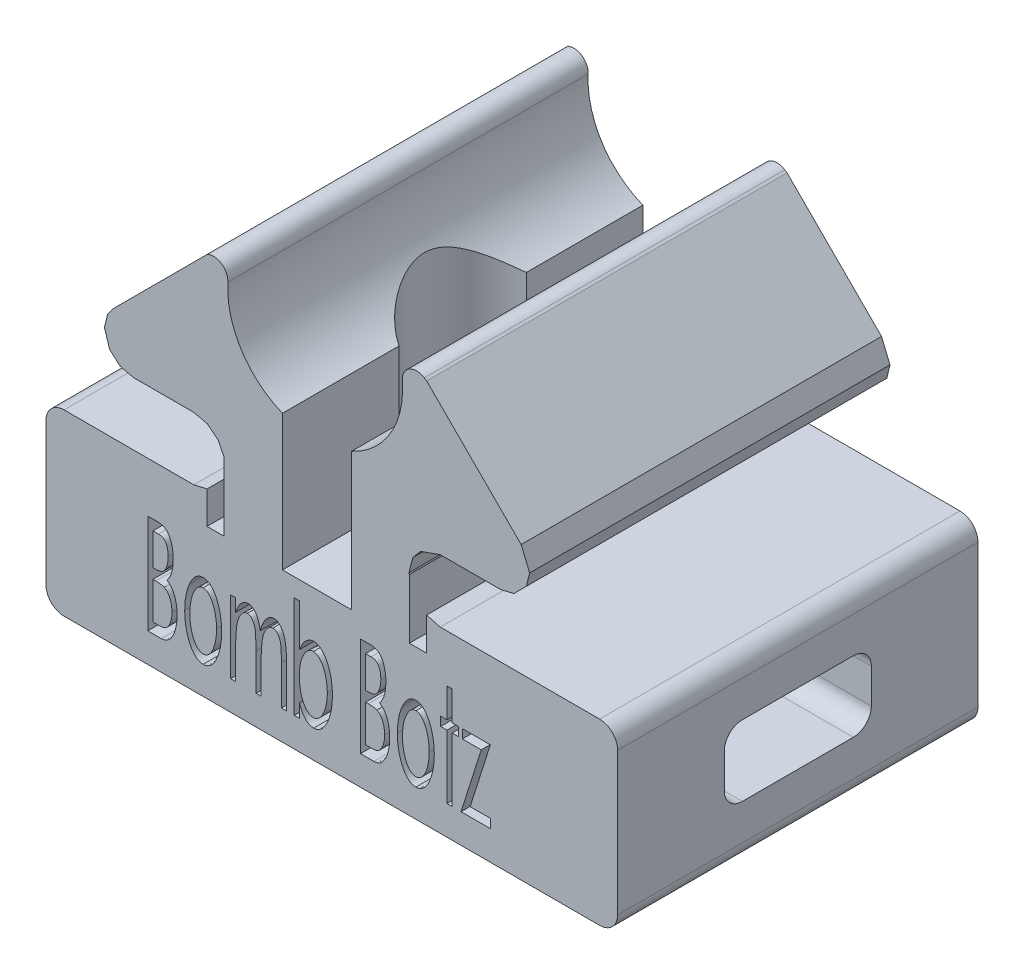
from build123d import *

# Parameters (mm, degrees)
BOSS_EXTRUDE1_DEPTH = 12.7
SKETCH10_R          = 3.082136138
CUT_EXTRUDE1_DEPTH  = 26.185474767
SKETCH11_W          = 2.435876878
SKETCH11_H          = 7.908405343
CUT_EXTRUDE2_DEPTH  = 26.185474767
SKETCH13_W          = 5.182015338
SKETCH13_H          = 2.489456313
CUT_EXTRUDE4_DEPTH  = 31.460304214
FILLET1_R           = 0.635
FILLET2_R           = 0.635
FILLET3_R           = 0.508
CUT_EXTRUDE5_DEPTH  = 1.27
SKETCH17_W          = 0.605016918
SKETCH17_H          = 2.095446093
SKETCH17_W_2        = 0.604461085
SKETCH17_H_2        = 2.141007526
CUT_EXTRUDE7_DEPTH  = 26.185474884
SKETCH18_R          = 2.54
CUT_EXTRUDE8_DEPTH  = 22.473952086


with BuildPart() as part:
    # Sketch5 → Boss-Extrude1 (new body)
    with BuildSketch(Plane.XY):
        Polygon((-6.474794456, -10.4902), (-6.938297275, -10.378313453), (-7.308763147, -10.05450356), (-7.490794456, -9.4742), (-7.378907909, -9.01069718), (-7.193214945, -8.75577951), (-3.863171405, -5.42573597), (-2.833127272, -4.737482484), (-1.618107374, -4.4958), (1.618107374, -4.4958), (2.668236067, -4.674493152), (3.863171405, -5.42573597), (7.193214945, -8.75577951), (7.490794456, -9.4742), (7.378907909, -9.93770282), (6.938297275, -10.378313453), (6.474794456, -10.4902), (4.3434, -10.4902), (3.646537163, -10.737670005), (3.377082754, -11.059343535), (3.2385, -11.5951), (3.485970005, -12.291962837), (3.807643535, -12.561417246), (4.3434, -12.7), (10.5918, -12.7), (10.5918, -18.995576116), (-9.5504, -18.995576116), (-9.5504, -12.7), (-4.3434, -12.7), (-3.863171405, -12.590180165), (-3.485969976, -12.291962837), (-3.271081829, -11.861441531), (-3.271081829, -11.328758469), (-3.485969976, -10.898237163), (-3.863171405, -10.600019835), (-4.3434, -10.4902), align=None)
    extrude(amount=-BOSS_EXTRUDE1_DEPTH)

    # Sketch10 → Cut-Extrude1 (cut, through all)
    with BuildSketch(Plane.XY):
        with Locations((-0.066530556, -6.095976424)):
            Circle(SKETCH10_R)
    extrude(amount=-CUT_EXTRUDE1_DEPTH, mode=Mode.SUBTRACT)

    # Sketch11 → Cut-Extrude2 (cut, through all)
    with BuildSketch(Plane.XY):
        with Locations((0, -9.781904855)):
            Rectangle(SKETCH11_W, SKETCH11_H)
    extrude(amount=-CUT_EXTRUDE2_DEPTH, mode=Mode.SUBTRACT)

    # Sketch13 → Cut-Extrude4 (cut, through all)
    with BuildSketch(Plane.ZY.offset(9.5504)):
        with Locations((-6.35, -15.847788058)):
            Rectangle(SKETCH13_W, SKETCH13_H)
    extrude(amount=-CUT_EXTRUDE4_DEPTH, mode=Mode.SUBTRACT)

    # Fillet1
    fillet1_edges = [part.edges().sort_by_distance(p)[0] for p in [
        (-9.5504, -12.7, -6.35),
    ]]
    fillet(fillet1_edges, radius=FILLET1_R)

    # Fillet2
    fillet2_edges = [part.edges().sort_by_distance(p)[0] for p in [
        (0.5207, -14.603059901, -3.758992331),
        (0.5207, -17.092516214, -3.758992331),
        (0.5207, -17.092516214, -8.941007669),
        (0.5207, -14.603059901, -8.941007669),
        (10.5918, -12.7, -6.35),
        (10.5918, -18.995576116, -6.35),
        (-9.5504, -18.995576116, -6.35),
    ]]
    fillet(fillet2_edges, radius=FILLET2_R)

    # Fillet3
    # the kernel refuses this fillet: 0.508 mm, written as the material it takes off along each edge
    with BuildSketch(Plane(origin=(2.668236067, -4.674493152, 3.28944818), x_dir=(0.8465916632907232, -0.5322429479538895, 0), z_dir=(0, 0, -1))) as fillet3_piece_1:
        with BuildLine():
            CenterArc((1.315779272, 0.508), FILLET3_R, 143.192029884, 126.807970116)
            Line((0.90905007, 0.812360569), (0.900915486, 0.81844778))
            ThreePointArc((0.900915486, 0.81844778), (0.488321858, 0.368360866), (-0.005137978, 0.008765089))
            Line((-0.005137978, 0.008765089), (0, -0.01016))
            Line((0, -0.01016), (1.315779272, -0.01016))
            Line((1.315779272, -0.01016), (1.315779272, 0))
        make_face()
    extrude(amount=19.278896361, mode=Mode.SUBTRACT)
    with BuildSketch(Plane(origin=(-2.833127272, -4.737482484, 3.097058862), x_dir=(-0.8314696122997464, -0.5555702330237908, 0), z_dir=(0, 0, -1))) as fillet3_piece_2:
        with BuildLine():
            CenterArc((1.31839441, -0.501729486), FILLET3_R, 99.011665767, 118.073467257)
            Line((0.913142276, -0.808054001), (0.905037233, -0.814180491))
            ThreePointArc((0.905037233, -0.814180491), (0.490196501, -0.366028623), (-0.005094947, -0.008790172))
            Line((-0.005094947, -0.008790172), (0, 0.01016))
            ThreePointArc((0, 0.01016), (0.619411772, 0.01016), (1.237232128, 0.01003459))
            Line((1.237232128, 0.01003459), (1.238823545, 0))
        make_face()
    extrude(amount=18.894117724, mode=Mode.SUBTRACT)

    # Sketch15 → Cut-Extrude5 (cut)
    # profile 1 of 8: a face of its own
    with BuildSketch(Plane.XY):
        with BuildLine():
            Line((-5.963589534, -14.467780526), (-5.62214322, -14.467780526))
            add(Edge.make_bspline(
                [(-5.62214322, -14.467780526), (-5.589534178, -14.46878798), (-5.527901506, -14.470692118), (-5.441516013, -14.490243243), (-5.365936065, -14.520174515), (-5.302987249, -14.566695465), (-5.249771139, -14.625144193), (-5.202864844, -14.696129356), (-5.163082389, -14.780723785), (-5.128349989, -14.876964552), (-5.101094391, -14.98243947), (-5.080415702, -15.094850671), (-5.068697057, -15.213056959), (-5.067011592, -15.293910926), (-5.066153636, -15.335068186)],
                knots=[0, 0, 0, 0, 1.007703189, 1.904607924, 2.728231251, 3.505327209, 4.303946819, 5.16473243, 6.128960489, 7.190833427, 8.327918668, 9.497182713, 10.725985794, 12, 12, 12, 12], degree=3))
            add(Edge.make_bspline(
                [(-5.066153636, -15.335068186), (-5.06679237, -15.37365502), (-5.068041356, -15.449108083), (-5.078819113, -15.559683483), (-5.09614865, -15.664916555), (-5.120267823, -15.7642439), (-5.151770234, -15.856240685), (-5.1893233, -15.939825865), (-5.233419851, -16.014982543), (-5.269354712, -16.058354109), (-5.287007002, -16.079659533)],
                knots=[0, 0, 0, 0, 1.167664483, 2.283262239, 3.358923896, 4.393422853, 5.373199395, 6.29755825, 7.163709169, 8, 8, 8, 8], degree=3))
            add(Edge.make_bspline(
                [(-5.287007002, -16.079659533), (-5.265820126, -16.095080339), (-5.224295143, -16.125304178), (-5.169500865, -16.178012614), (-5.121183642, -16.233812414), (-5.081674484, -16.295437248), (-5.048107352, -16.361552921), (-5.017327508, -16.432968522), (-4.992028559, -16.511264668), (-4.970278844, -16.595558431), (-4.953059318, -16.684537391), (-4.940091307, -16.777884919), (-4.933516036, -16.874870461), (-4.932203241, -16.940862846), (-4.931538252, -16.974290943)],
                knots=[0, 0, 0, 0, 0.940213205, 1.842760421, 2.724135194, 3.585617653, 4.464149597, 5.385626676, 6.375777621, 7.416178614, 8.510967562, 9.629286614, 10.799127532, 12, 12, 12, 12], degree=3))
            add(Edge.make_bspline(
                [(-4.931538252, -16.974290943), (-4.931796917, -17.008429669), (-4.932304329, -17.075398123), (-4.940567322, -17.17364715), (-4.952378885, -17.267695274), (-4.968054258, -17.358033369), (-4.990305018, -17.444204206), (-5.01563402, -17.526922141), (-5.046920587, -17.605290821), (-5.082042167, -17.678765991), (-5.121005728, -17.746111774), (-5.163309515, -17.805500706), (-5.210257707, -17.854922704), (-5.259417575, -17.896441948), (-5.312482472, -17.928350746), (-5.368830889, -17.950905706), (-5.428325845, -17.965867284), (-5.469440698, -17.967135904), (-5.490332322, -17.967780526)],
                knots=[0, 0, 0, 0, 1.305706815, 2.561348188, 3.769087172, 4.931904447, 6.066077104, 7.171803036, 8.239419409, 9.29119266, 10.284925843, 11.21314407, 12.073370583, 12.886194184, 13.668239408, 14.430351689, 15.202417108, 16, 16, 16, 16], degree=3))
            Line((-5.490332322, -17.967780526), (-5.963589534, -17.967780526))
            Line((-5.963589534, -17.967780526), (-5.963589534, -14.467780526))
        make_face()
        with BuildLine():
            Line((-5.784102354, -14.826754885), (-5.784102354, -15.948549757))
            Line((-5.784102354, -15.948549757), (-5.686646425, -15.948549757))
            add(Edge.make_bspline(
                [(-5.686646425, -15.948549757), (-5.659024836, -15.947836275), (-5.607419502, -15.946503279), (-5.535531687, -15.934491662), (-5.475447719, -15.912718893), (-5.425307923, -15.882594026), (-5.384948483, -15.841407515), (-5.349161734, -15.792451241), (-5.319359759, -15.732824027), (-5.29311326, -15.665473087), (-5.271485576, -15.590896983), (-5.256477584, -15.511302634), (-5.246952842, -15.42761469), (-5.246085687, -15.370618638), (-5.245640816, -15.341378283)],
                knots=[0, 0, 0, 0, 1.158126998, 2.163725294, 3.041371376, 3.824793678, 4.594170469, 5.443102772, 6.359364395, 7.380511659, 8.472453147, 9.610495495, 10.77412628, 12, 12, 12, 12], degree=3))
            add(Edge.make_bspline(
                [(-5.245640816, -15.341378283), (-5.24643037, -15.303463298), (-5.247929231, -15.231486835), (-5.263088834, -15.129866037), (-5.288825731, -15.041027529), (-5.319010095, -14.976200149), (-5.34839721, -14.931644521), (-5.373618308, -14.903711491), (-5.401732116, -14.880006633), (-5.432539782, -14.859931293), (-5.467482314, -14.845732101), (-5.504641724, -14.834052065), (-5.545054209, -14.827941221), (-5.572813815, -14.827157735), (-5.58708713, -14.826754885)],
                knots=[0, 0, 0, 0, 1.952265271, 3.706111235, 5.27563019, 6.702738451, 7.37059395, 8.018508953, 8.633599442, 9.261517843, 9.903363777, 10.569915718, 11.264685426, 12, 12, 12, 12], degree=3))
            Line((-5.58708713, -14.826754885), (-5.784102354, -14.826754885))
        make_face(mode=Mode.SUBTRACT)
        with BuildLine():
            Line((-5.784102354, -16.307524116), (-5.784102354, -17.608806167))
            Line((-5.784102354, -17.608806167), (-5.574466938, -17.608806167))
            add(Edge.make_bspline(
                [(-5.574466938, -17.608806167), (-5.545407451, -17.608279987), (-5.491098027, -17.607296608), (-5.416043649, -17.593031784), (-5.352619022, -17.571529907), (-5.301002884, -17.538212916), (-5.258588115, -17.495091397), (-5.222477059, -17.442073954), (-5.189088856, -17.380049388), (-5.162193525, -17.308103991), (-5.139049701, -17.23018603), (-5.12321637, -17.147500883), (-5.113116047, -17.061948199), (-5.111728433, -17.003767041), (-5.111025431, -16.974290943)],
                knots=[0, 0, 0, 0, 1.164888785, 2.177066614, 3.05569501, 3.836540044, 4.619468312, 5.468124174, 6.404245127, 7.441045181, 8.545645698, 9.66450176, 10.816775421, 12, 12, 12, 12], degree=3))
            add(Edge.make_bspline(
                [(-5.111025431, -16.974290943), (-5.112049658, -16.937796388), (-5.114039567, -16.866893291), (-5.127041238, -16.764109234), (-5.150280649, -16.668661019), (-5.182292887, -16.581426879), (-5.221313133, -16.50341528), (-5.268708874, -16.438209418), (-5.322335588, -16.384438771), (-5.364892372, -16.360625795), (-5.385865175, -16.348890302)],
                knots=[0, 0, 0, 0, 1.222452466, 2.375030106, 3.46297454, 4.505675201, 5.48249602, 6.37345105, 7.198405334, 8, 8, 8, 8], degree=3))
            add(Edge.make_bspline(
                [(-5.385865175, -16.348890302), (-5.402761888, -16.342238106), (-5.44117002, -16.327116914), (-5.509900884, -16.316718034), (-5.5936596, -16.308808196), (-5.654827904, -16.307976055), (-5.688048668, -16.307524116)],
                knots=[0, 0, 0, 0, 0.708155266, 1.609716739, 2.701827025, 4, 4, 4, 4], degree=3))
            Line((-5.688048668, -16.307524116), (-5.784102354, -16.307524116))
        make_face(mode=Mode.SUBTRACT)
    # profile 2 of 8: a face of its own
    with BuildSketch(Plane.XY):
        with BuildLine():
            add(Edge.make_bspline(
                [(-4.010965335, -15.365216424), (-3.987202577, -15.366280698), (-3.939938498, -15.368397537), (-3.871505784, -15.390184301), (-3.806668863, -15.424042529), (-3.744146766, -15.470102283), (-3.686232268, -15.530740461), (-3.631389386, -15.603917735), (-3.579378926, -15.689950096), (-3.549286287, -15.753339913), (-3.533501393, -15.786590622)],
                knots=[0, 0, 0, 0, 0.843577701, 1.677874383, 2.529941952, 3.44009667, 4.428447994, 5.503311921, 6.690378774, 8, 8, 8, 8], degree=3))
            add(Edge.make_bspline(
                [(-3.533501393, -15.786590622), (-3.519491202, -15.819131254), (-3.491125789, -15.885013897), (-3.456655297, -15.988080509), (-3.427184931, -16.095315949), (-3.402160687, -16.206805054), (-3.384970642, -16.323147295), (-3.370077074, -16.443447004), (-3.362863943, -16.568252573), (-3.361644666, -16.65293694), (-3.361025431, -16.69594559)],
                knots=[0, 0, 0, 0, 0.911590579, 1.845630971, 2.79426017, 3.773633235, 4.784390523, 5.820063118, 6.892875455, 8, 8, 8, 8], degree=3))
            add(Edge.make_bspline(
                [(-3.361025431, -16.69594559), (-3.361572897, -16.739192091), (-3.362651139, -16.824366626), (-3.37090819, -16.950086518), (-3.386174601, -17.071620024), (-3.404944066, -17.189345325), (-3.431700919, -17.30258021), (-3.461713559, -17.412049943), (-3.499500821, -17.516938511), (-3.541458488, -17.616603421), (-3.587318855, -17.708603167), (-3.638080994, -17.788948002), (-3.691023083, -17.857925388), (-3.748369165, -17.914123077), (-3.808887337, -17.958344391), (-3.873066612, -17.989976554), (-3.940946523, -18.008956451), (-3.987476748, -18.0114125), (-4.010965335, -18.012652321)],
                knots=[0, 0, 0, 0, 1.301298947, 2.562924903, 3.788461415, 4.986201962, 6.14793309, 7.287790237, 8.39993342, 9.49971249, 10.540722194, 11.488924044, 12.355509222, 13.151197152, 13.89676473, 14.601269901, 15.293917145, 16, 16, 16, 16], degree=3))
            add(Edge.make_bspline(
                [(-4.010965335, -18.012652321), (-4.034447933, -18.011387838), (-4.081191959, -18.008870782), (-4.149369699, -17.990121666), (-4.213761248, -17.958353131), (-4.274315659, -17.913932457), (-4.332295632, -17.857975775), (-4.386002732, -17.789163365), (-4.436693222, -17.708580269), (-4.482509623, -17.616586344), (-4.524808833, -17.517109534), (-4.561115474, -17.411749669), (-4.592928896, -17.302850789), (-4.617764342, -17.189125104), (-4.638446077, -17.071781546), (-4.652069501, -16.950009813), (-4.660775452, -16.824379546), (-4.661791563, -16.739196442), (-4.662307483, -16.69594559)],
                knots=[0, 0, 0, 0, 0.705440217, 1.4042363, 2.108100269, 2.852989273, 3.652997896, 4.523145192, 5.47048404, 6.510546275, 7.609324387, 8.718120464, 9.858867499, 11.017987859, 12.215813406, 13.439407729, 14.699885423, 16, 16, 16, 16], degree=3))
            add(Edge.make_bspline(
                [(-4.662307483, -16.69594559), (-4.661692969, -16.6531693), (-4.660479734, -16.568716052), (-4.653158423, -16.444164378), (-4.638734442, -16.323982861), (-4.620028849, -16.208371479), (-4.596193049, -16.096905412), (-4.566883832, -15.989878754), (-4.532055218, -15.88693716), (-4.503820373, -15.821242279), (-4.489831521, -15.788693988)],
                knots=[0, 0, 0, 0, 1.103600926, 2.178839769, 3.216854868, 4.224898256, 5.199312966, 6.155900535, 7.086347569, 8, 8, 8, 8], degree=3))
            add(Edge.make_bspline(
                [(-4.489831521, -15.788693988), (-4.474076444, -15.755193626), (-4.444121502, -15.691499782), (-4.391770495, -15.605051551), (-4.336662092, -15.531607251), (-4.278278402, -15.47116933), (-4.216700031, -15.423544314), (-4.151036233, -15.390265385), (-4.082220383, -15.368444874), (-4.034729354, -15.366293133), (-4.010965335, -15.365216424)],
                knots=[0, 0, 0, 0, 1.3116991, 2.493918051, 3.576000503, 4.560315464, 5.46508553, 6.321043193, 7.159867415, 8, 8, 8, 8], degree=3))
        make_face()
        with BuildLine():
            add(Edge.make_bspline(
                [(-4.011666457, -15.679318988), (-4.02766861, -15.680288622), (-4.059590517, -15.682222898), (-4.106161569, -15.69726926), (-4.150823162, -15.720629207), (-4.193456831, -15.754082854), (-4.234744119, -15.796042499), (-4.273132084, -15.848242325), (-4.310400991, -15.908977592), (-4.345516199, -15.978164139), (-4.377205156, -16.054295668), (-4.406154237, -16.134615747), (-4.429970545, -16.218969048), (-4.448660164, -16.307367435), (-4.464095488, -16.399508548), (-4.475388436, -16.495655751), (-4.481626503, -16.595600463), (-4.482417154, -16.663451854), (-4.482820303, -16.698048956)],
                knots=[0, 0, 0, 0, 0.633328474, 1.263395849, 1.922297409, 2.622747561, 3.402359392, 4.249154536, 5.185072166, 6.225072861, 7.321168891, 8.452296706, 9.607823688, 10.792618436, 12.032427099, 13.310317054, 14.628543482, 16, 16, 16, 16], degree=3))
            add(Edge.make_bspline(
                [(-4.482820303, -16.698048956), (-4.481983217, -16.742714023), (-4.480332326, -16.830801916), (-4.468144573, -16.960540589), (-4.448678688, -17.08563532), (-4.421710713, -17.204465543), (-4.3881774, -17.314706881), (-4.34752978, -17.412579999), (-4.30313266, -17.498328555), (-4.252018464, -17.569291109), (-4.19696323, -17.626499948), (-4.137844282, -17.667210228), (-4.076062094, -17.694418002), (-4.032961036, -17.697183454), (-4.011666457, -17.698549757)],
                knots=[0, 0, 0, 0, 1.343625255, 2.649881141, 3.916827948, 5.150040387, 6.313170605, 7.378672881, 8.334918638, 9.211145051, 10.001680462, 10.70963726, 11.362481287, 12, 12, 12, 12], degree=3))
            add(Edge.make_bspline(
                [(-4.011666457, -17.698549757), (-3.990369901, -17.697185509), (-3.947264841, -17.694424218), (-3.885514088, -17.667183763), (-3.826395718, -17.62670676), (-3.772009812, -17.569044862), (-3.721018335, -17.498165071), (-3.67549436, -17.412945113), (-3.636082439, -17.31450229), (-3.60244675, -17.204401311), (-3.574436639, -17.085734345), (-3.555251226, -16.960527488), (-3.542984135, -16.830805344), (-3.541344161, -16.742715176), (-3.540512611, -16.698048956)],
                knots=[0, 0, 0, 0, 0.63766136, 1.290651464, 1.99876667, 2.784553339, 3.660975812, 4.620765142, 5.683833951, 6.847224424, 8.082295646, 9.349525938, 10.656074103, 12, 12, 12, 12], degree=3))
            add(Edge.make_bspline(
                [(-3.540512611, -16.698048956), (-3.540917405, -16.663452192), (-3.541711282, -16.595601464), (-3.547926106, -16.495651974), (-3.55930322, -16.399522074), (-3.574447572, -16.3072699), (-3.594205809, -16.219039843), (-3.618090984, -16.134784375), (-3.645763882, -16.053971854), (-3.678714058, -15.978336365), (-3.713642118, -15.909008419), (-3.750767855, -15.847948896), (-3.790082493, -15.796526425), (-3.830551542, -15.753837561), (-3.873247933, -15.720664094), (-3.917863454, -15.697259641), (-3.964221929, -15.68230091), (-3.995901747, -15.680309811), (-4.011666457, -15.679318988)],
                knots=[0, 0, 0, 0, 1.372102031, 2.690948916, 3.969440344, 5.209832555, 6.397176509, 7.553247371, 8.681828641, 9.782077646, 10.822567844, 11.758925988, 12.611729478, 13.385237583, 14.08601742, 14.74522911, 15.375593043, 16, 16, 16, 16], degree=3))
        make_face(mode=Mode.SUBTRACT)
    # profile 3 of 8: a face of its own
    with BuildSketch(Plane.XY):
        with BuildLine():
            Line((-3.046922867, -15.410088218), (-2.867435688, -15.410088218))
            Line((-2.867435688, -15.410088218), (-2.867435688, -15.854599436))
            add(Edge.make_bspline(
                [(-2.867435688, -15.854599436), (-2.853298321, -15.816026088), (-2.826740088, -15.743562812), (-2.780775186, -15.645548815), (-2.736282157, -15.562696143), (-2.701775979, -15.516330211), (-2.685845143, -15.494923956)],
                knots=[0, 0, 0, 0, 1.217816216, 2.287770118, 3.209496512, 4, 4, 4, 4], degree=3))
            add(Edge.make_bspline(
                [(-2.685845143, -15.494923956), (-2.664998425, -15.475175166), (-2.625221796, -15.437493441), (-2.557676535, -15.396119877), (-2.487815224, -15.370462583), (-2.440186597, -15.366953252), (-2.416614374, -15.365216424)],
                knots=[0, 0, 0, 0, 1.120991578, 2.138910614, 3.078914958, 4, 4, 4, 4], degree=3))
            add(Edge.make_bspline(
                [(-2.416614374, -15.365216424), (-2.400879607, -15.366305636), (-2.369102749, -15.368505336), (-2.322137155, -15.382041691), (-2.277283011, -15.406274784), (-2.234089026, -15.438666257), (-2.193240891, -15.478357792), (-2.155697853, -15.524380348), (-2.122645874, -15.576692154), (-2.093725851, -15.636395854), (-2.066439025, -15.705113573), (-2.042541969, -15.785933491), (-2.020118981, -15.87982936), (-2.007546153, -15.94708209), (-2.000849149, -15.982904725)],
                knots=[0, 0, 0, 0, 0.70497467, 1.423718626, 2.167988911, 2.97590154, 3.834418343, 4.712110969, 5.629520406, 6.598314936, 7.678802742, 8.936786955, 10.368358232, 12, 12, 12, 12], degree=3))
            add(Edge.make_bspline(
                [(-2.000849149, -15.982904725), (-1.986622637, -15.935220942), (-1.959649447, -15.844813417), (-1.910077395, -15.719927803), (-1.854952378, -15.613259325), (-1.795069115, -15.524564372), (-1.730352825, -15.454687607), (-1.662801731, -15.403380808), (-1.591245647, -15.37115347), (-1.541907864, -15.367166495), (-1.517776233, -15.365216424)],
                knots=[0, 0, 0, 0, 1.430898735, 2.712956173, 3.858598611, 4.878593333, 5.782223817, 6.584917614, 7.307868261, 8, 8, 8, 8], degree=3))
            add(Edge.make_bspline(
                [(-1.517776233, -15.365216424), (-1.495595535, -15.366905958), (-1.451030067, -15.370300571), (-1.386623503, -15.396215434), (-1.328391395, -15.440397528), (-1.274563957, -15.499365455), (-1.225687699, -15.572616424), (-1.183964629, -15.659643461), (-1.149120369, -15.759682058), (-1.125789975, -15.852102452), (-1.110301936, -15.934776278), (-1.099775105, -16.005380488), (-1.091664958, -16.083540889), (-1.084689649, -16.168867434), (-1.079191541, -16.261673774), (-1.074832686, -16.361940096), (-1.072994567, -16.469709887), (-1.072710421, -16.544035558), (-1.072563893, -16.582363859)],
                knots=[0, 0, 0, 0, 0.756463087, 1.519885966, 2.330984414, 3.234758128, 4.235496569, 5.327959897, 6.52219358, 7.848426635, 8.57957358, 9.394668963, 10.285911105, 11.263066096, 12.318715349, 13.461245202, 14.690813573, 16, 16, 16, 16], degree=3))
            Line((-1.072563893, -16.582363859), (-1.072563893, -17.967780526))
            Line((-1.072563893, -17.967780526), (-1.252051072, -17.967780526))
            Line((-1.252051072, -17.967780526), (-1.252051072, -16.580961616))
            add(Edge.make_bspline(
                [(-1.252051072, -16.580961616), (-1.252221688, -16.548241857), (-1.252549529, -16.485370322), (-1.254022878, -16.395157924), (-1.255813841, -16.312867334), (-1.259435853, -16.238781401), (-1.263638477, -16.172636596), (-1.268195165, -16.114363754), (-1.274515396, -16.064104763), (-1.283538316, -16.008642073), (-1.298324189, -15.94791788), (-1.320043218, -15.881734776), (-1.348470382, -15.82330681), (-1.381642423, -15.773267646), (-1.418605965, -15.731380524), (-1.46045825, -15.701396936), (-1.506402975, -15.682163475), (-1.538626384, -15.680274871), (-1.554935688, -15.679318988)],
                knots=[0, 0, 0, 0, 1.51836297, 2.917558436, 4.186860745, 5.337727298, 6.359248196, 7.262593179, 8.049522409, 8.709208536, 9.869236563, 10.946135496, 11.935605254, 12.874073121, 13.726161472, 14.511594637, 15.246670199, 16, 16, 16, 16], degree=3))
            add(Edge.make_bspline(
                [(-1.554935688, -15.679318988), (-1.57511471, -15.680857345), (-1.616325536, -15.683999072), (-1.674632394, -15.713688311), (-1.729758785, -15.758687159), (-1.780379238, -15.820823021), (-1.82706878, -15.896431793), (-1.866921396, -15.98491855), (-1.899129739, -16.085018487), (-1.921729946, -16.176670849), (-1.934944579, -16.259476006), (-1.945074605, -16.332333932), (-1.952344063, -16.415186802), (-1.958389799, -16.507775482), (-1.964389927, -16.610115024), (-1.967446931, -16.722339295), (-1.969661239, -16.844340431), (-1.969884072, -16.928950433), (-1.96999979, -16.972888699)],
                knots=[0, 0, 0, 0, 0.660002353, 1.34789691, 2.107969646, 2.991979148, 3.96914392, 5.025409628, 6.175424129, 7.424845589, 8.126354717, 8.933170354, 9.844345944, 10.861583212, 11.98578703, 13.216546376, 14.554542928, 16, 16, 16, 16], degree=3))
            Line((-1.96999979, -16.972888699), (-1.96999979, -17.967780526))
            Line((-1.96999979, -17.967780526), (-2.14948697, -17.967780526))
            Line((-2.14948697, -17.967780526), (-2.14948697, -16.667199597))
            add(Edge.make_bspline(
                [(-2.14948697, -16.667199597), (-2.149665377, -16.630507108), (-2.150008566, -16.559924117), (-2.151380899, -16.458724822), (-2.153484187, -16.366638964), (-2.156096035, -16.283885796), (-2.159962342, -16.210443031), (-2.16616121, -16.146257419), (-2.170914772, -16.091157584), (-2.180523372, -16.031210124), (-2.193654481, -15.965652027), (-2.21712588, -15.895350445), (-2.244783453, -15.832815175), (-2.278395663, -15.779519837), (-2.315835523, -15.735148391), (-2.358164556, -15.702706269), (-2.404985971, -15.683025047), (-2.437471787, -15.680557335), (-2.453773829, -15.679318988)],
                knots=[0, 0, 0, 0, 1.574861193, 3.029459675, 4.343833698, 5.52814318, 6.583091089, 7.499410718, 8.295893451, 8.955563666, 10.104512628, 11.160794949, 12.130411979, 13.03206512, 13.856786337, 14.609093303, 15.302014803, 16, 16, 16, 16], degree=3))
            add(Edge.make_bspline(
                [(-2.453773829, -15.679318988), (-2.47299374, -15.68096486), (-2.512689613, -15.684364165), (-2.569417632, -15.713092844), (-2.62327393, -15.757186432), (-2.673810878, -15.817473177), (-2.720397506, -15.891454544), (-2.759659107, -15.978668857), (-2.794453143, -16.076732007), (-2.816488361, -16.167410788), (-2.831046134, -16.247960534), (-2.840852402, -16.317188947), (-2.849028046, -16.39413382), (-2.856229779, -16.478737852), (-2.860553372, -16.57112984), (-2.865232888, -16.670896951), (-2.866994243, -16.778671953), (-2.867284892, -16.852996943), (-2.867435688, -16.891558571)],
                knots=[0, 0, 0, 0, 0.667901347, 1.379451074, 2.174339452, 3.088250632, 4.111091931, 5.216854925, 6.419016473, 7.738532864, 8.468087668, 9.275556869, 10.178113764, 11.168435705, 12.23848396, 13.405914129, 14.654124622, 16, 16, 16, 16], degree=3))
            Line((-2.867435688, -16.891558571), (-2.867435688, -17.967780526))
            Line((-2.867435688, -17.967780526), (-3.046922867, -17.967780526))
            Line((-3.046922867, -17.967780526), (-3.046922867, -15.410088218))
        make_face()
    # profile 4 of 8: a face of its own
    with BuildSketch(Plane.XY):
        with BuildLine():
            Line((-0.803333124, -17.967780526), (-0.803333124, -14.378036936))
            Line((-0.803333124, -14.378036936), (-0.623845944, -14.378036936))
            Line((-0.623845944, -14.378036936), (-0.623845944, -15.874230847))
            add(Edge.make_bspline(
                [(-0.623845944, -15.874230847), (-0.606769209, -15.833944157), (-0.574419832, -15.757626916), (-0.517819166, -15.65383745), (-0.459451289, -15.565212242), (-0.396960821, -15.492513369), (-0.330424144, -15.436086241), (-0.26098279, -15.395058873), (-0.187626362, -15.369434782), (-0.137230441, -15.366622746), (-0.112027034, -15.365216424)],
                knots=[0, 0, 0, 0, 1.371279927, 2.597689275, 3.70130467, 4.693297749, 5.593093873, 6.423879366, 7.211769328, 8, 8, 8, 8], degree=3))
            add(Edge.make_bspline(
                [(-0.112027034, -15.365216424), (-0.089695821, -15.366452655), (-0.045216851, -15.368914961), (0.019855829, -15.388284612), (0.082232159, -15.41903263), (0.142460688, -15.461483986), (0.198542247, -15.517523417), (0.252551202, -15.584677097), (0.304572061, -15.663703206), (0.352608216, -15.754131847), (0.3969118, -15.852805107), (0.436560038, -15.957555008), (0.468981155, -16.06785577), (0.496887254, -16.182832765), (0.516432791, -16.303418262), (0.532216053, -16.428709139), (0.541416134, -16.559555882), (0.542346343, -16.64848897), (0.542820723, -16.693842225)],
                knots=[0, 0, 0, 0, 0.666834484, 1.328190814, 2.012624616, 2.739681146, 3.52046551, 4.375006532, 5.313068699, 6.344837697, 7.433265496, 8.545590816, 9.690816455, 10.868811167, 12.080825012, 13.341092928, 14.64403571, 16, 16, 16, 16], degree=3))
            add(Edge.make_bspline(
                [(0.542820723, -16.693842225), (0.542347641, -16.738495444), (0.54141778, -16.826263153), (0.532152526, -16.955461669), (0.516635571, -17.079674044), (0.495929129, -17.199157336), (0.468508823, -17.313354739), (0.435505106, -17.422771353), (0.396513313, -17.527164033), (0.351227078, -17.625203427), (0.302193703, -17.714818996), (0.250482356, -17.794073426), (0.196009944, -17.861174839), (0.138526126, -17.916072263), (0.078856427, -17.959815244), (0.015699071, -17.990441119), (-0.050020484, -18.008690721), (-0.09462314, -18.011331377), (-0.116934886, -18.012652321)],
                knots=[0, 0, 0, 0, 1.340122652, 2.634065311, 3.885240942, 5.096185043, 6.271872362, 7.408055191, 8.524644743, 9.613771782, 10.64668928, 11.58834762, 12.450598855, 13.234564774, 13.968476263, 14.661843387, 15.330609126, 16, 16, 16, 16], degree=3))
            add(Edge.make_bspline(
                [(-0.116934886, -18.012652321), (-0.142340535, -18.011152077), (-0.193280849, -18.008143971), (-0.267609298, -17.983968904), (-0.337067568, -17.943303631), (-0.403675261, -17.888138654), (-0.465373587, -17.815281046), (-0.522732621, -17.724527441), (-0.577337372, -17.616560169), (-0.607779294, -17.536681637), (-0.623845944, -17.494523315)],
                knots=[0, 0, 0, 0, 0.787562838, 1.579125175, 2.397976651, 3.273906639, 4.251222186, 5.347932763, 6.600290935, 8, 8, 8, 8], degree=3))
            Line((-0.623845944, -17.494523315), (-0.623845944, -17.967780526))
            Line((-0.623845944, -17.967780526), (-0.803333124, -17.967780526))
        make_face()
        with BuildLine():
            add(Edge.make_bspline(
                [(-0.130957322, -17.698549757), (-0.108762514, -17.696868232), (-0.063950567, -17.693473185), (0.001011679, -17.667008405), (0.062002828, -17.624293263), (0.119198714, -17.565700803), (0.173305693, -17.493427667), (0.220251736, -17.40628201), (0.262387997, -17.306733517), (0.297942132, -17.195640488), (0.327182508, -17.076177236), (0.347845939, -16.951717085), (0.361032288, -16.823833855), (0.36255928, -16.737578221), (0.363333543, -16.693842225)],
                knots=[0, 0, 0, 0, 0.657786529, 1.328089627, 2.052027622, 2.856990137, 3.749654712, 4.725235723, 5.788901291, 6.956707324, 8.185706879, 9.438700918, 10.701291008, 12, 12, 12, 12], degree=3))
            add(Edge.make_bspline(
                [(0.363333543, -16.693842225), (0.362515262, -16.6501124), (0.360892754, -16.563403749), (0.348237752, -16.434931056), (0.326053949, -16.309764089), (0.297347519, -16.18922513), (0.261550625, -16.076829562), (0.219912862, -15.975740199), (0.171602379, -15.888043707), (0.117775618, -15.814445845), (0.061084807, -15.754171379), (-0.00030003, -15.712198563), (-0.06348854, -15.684265966), (-0.107322823, -15.680948505), (-0.128853957, -15.679318988)],
                knots=[0, 0, 0, 0, 1.292893791, 2.563583935, 3.812134528, 5.049061508, 6.224790131, 7.296423726, 8.277031188, 9.176806139, 9.98799582, 10.708692254, 11.36571745, 12, 12, 12, 12], degree=3))
            add(Edge.make_bspline(
                [(-0.128853957, -15.679318988), (-0.150605532, -15.680974913), (-0.195082482, -15.684360897), (-0.259501399, -15.712090207), (-0.322370505, -15.754448971), (-0.3815601, -15.81397911), (-0.437406001, -15.886280144), (-0.485490032, -15.972034449), (-0.528642743, -16.06819276), (-0.562838674, -16.176082429), (-0.58981971, -16.292663356), (-0.609366557, -16.41683763), (-0.621416857, -16.548004666), (-0.623023281, -16.637959754), (-0.623845944, -16.68402652)],
                knots=[0, 0, 0, 0, 0.642827838, 1.314434586, 2.048503311, 2.881431429, 3.790527276, 4.749602412, 5.788656785, 6.910486039, 8.098690173, 9.333453703, 10.634438985, 12, 12, 12, 12], degree=3))
            add(Edge.make_bspline(
                [(-0.623845944, -16.68402652), (-0.62352508, -16.719329959), (-0.62289543, -16.788607872), (-0.615501691, -16.890359778), (-0.604560639, -16.987720209), (-0.589042526, -17.080612576), (-0.569709236, -17.169240555), (-0.545067439, -17.253231984), (-0.516458906, -17.333046413), (-0.483002563, -17.407130058), (-0.447173655, -17.474919904), (-0.408587151, -17.534146224), (-0.368069911, -17.584914255), (-0.324169197, -17.625219121), (-0.279967439, -17.65913394), (-0.231970841, -17.681258289), (-0.182379319, -17.696567976), (-0.148132775, -17.697887822), (-0.130957322, -17.698549757)],
                knots=[0, 0, 0, 0, 1.383204787, 2.714340084, 3.995776056, 5.221372194, 6.403491579, 7.548302738, 8.649227815, 9.723273024, 10.731247881, 11.650798515, 12.490437703, 13.267992902, 13.982413771, 14.662427744, 15.329175827, 16, 16, 16, 16], degree=3))
        make_face(mode=Mode.SUBTRACT)
    # profile 5 of 8: a face of its own
    with BuildSketch(Plane.XY):
        with BuildLine():
            Line((1.53000021, -14.467780526), (1.871446524, -14.467780526))
            add(Edge.make_bspline(
                [(1.871446524, -14.467780526), (1.904055566, -14.46878798), (1.965688237, -14.470692118), (2.05207373, -14.490243243), (2.127653679, -14.520174515), (2.190602495, -14.566695465), (2.243818604, -14.625144193), (2.290724899, -14.696129356), (2.330507355, -14.780723785), (2.365239755, -14.876964552), (2.392495352, -14.98243947), (2.413174042, -15.094850671), (2.424892687, -15.213056959), (2.426578152, -15.293910926), (2.427436107, -15.335068186)],
                knots=[0, 0, 0, 0, 1.007703189, 1.904607924, 2.728231251, 3.505327209, 4.303946819, 5.16473243, 6.128960489, 7.190833427, 8.327918668, 9.497182713, 10.725985794, 12, 12, 12, 12], degree=3))
            add(Edge.make_bspline(
                [(2.427436107, -15.335068186), (2.426797374, -15.37365502), (2.425548388, -15.449108083), (2.41477063, -15.559683483), (2.397441093, -15.664916555), (2.373321921, -15.7642439), (2.34181951, -15.856240685), (2.304266443, -15.939825865), (2.260169893, -16.014982543), (2.224235032, -16.058354109), (2.206582742, -16.079659533)],
                knots=[0, 0, 0, 0, 1.167664483, 2.283262239, 3.358923896, 4.393422853, 5.373199395, 6.29755825, 7.163709169, 8, 8, 8, 8], degree=3))
            add(Edge.make_bspline(
                [(2.206582742, -16.079659533), (2.227769618, -16.095080339), (2.2692946, -16.125304178), (2.324088879, -16.178012614), (2.372406102, -16.233812414), (2.411915259, -16.295437248), (2.445482392, -16.361552921), (2.476262236, -16.432968522), (2.501561184, -16.511264668), (2.5233109, -16.595558431), (2.540530426, -16.684537391), (2.553498437, -16.777884919), (2.560073708, -16.874870461), (2.561386503, -16.940862846), (2.562051492, -16.974290943)],
                knots=[0, 0, 0, 0, 0.940213205, 1.842760421, 2.724135194, 3.585617653, 4.464149597, 5.385626676, 6.375777621, 7.416178614, 8.510967562, 9.629286614, 10.799127532, 12, 12, 12, 12], degree=3))
            add(Edge.make_bspline(
                [(2.562051492, -16.974290943), (2.561792827, -17.008429669), (2.561285415, -17.075398123), (2.553022422, -17.17364715), (2.541210859, -17.267695274), (2.525535486, -17.358033369), (2.503284726, -17.444204206), (2.477955724, -17.526922141), (2.446669157, -17.605290821), (2.411547577, -17.678765991), (2.372584016, -17.746111774), (2.330280229, -17.805500706), (2.283332037, -17.854922704), (2.234172168, -17.896441948), (2.181107271, -17.928350746), (2.124758855, -17.950905706), (2.065263898, -17.965867284), (2.024149046, -17.967135904), (2.003257421, -17.967780526)],
                knots=[0, 0, 0, 0, 1.305706815, 2.561348188, 3.769087172, 4.931904447, 6.066077104, 7.171803036, 8.239419409, 9.29119266, 10.284925843, 11.21314407, 12.073370583, 12.886194184, 13.668239408, 14.430351689, 15.202417108, 16, 16, 16, 16], degree=3))
            Line((2.003257421, -17.967780526), (1.53000021, -17.967780526))
            Line((1.53000021, -17.967780526), (1.53000021, -14.467780526))
        make_face()
        with BuildLine():
            Line((1.709487389, -14.826754885), (1.709487389, -15.948549757))
            Line((1.709487389, -15.948549757), (1.806943319, -15.948549757))
            add(Edge.make_bspline(
                [(1.806943319, -15.948549757), (1.834564907, -15.947836275), (1.886170241, -15.946503279), (1.958058057, -15.934491662), (2.018142024, -15.912718893), (2.068281821, -15.882594026), (2.108641261, -15.841407515), (2.144428009, -15.792451241), (2.174229984, -15.732824027), (2.200476483, -15.665473087), (2.222104168, -15.590896983), (2.237112159, -15.511302634), (2.246636902, -15.42761469), (2.247504056, -15.370618638), (2.247948928, -15.341378283)],
                knots=[0, 0, 0, 0, 1.158126998, 2.163725294, 3.041371376, 3.824793678, 4.594170469, 5.443102772, 6.359364395, 7.380511659, 8.472453147, 9.610495495, 10.77412628, 12, 12, 12, 12], degree=3))
            add(Edge.make_bspline(
                [(2.247948928, -15.341378283), (2.247159374, -15.303463298), (2.245660512, -15.231486835), (2.23050091, -15.129866037), (2.204764012, -15.041027529), (2.174579648, -14.976200149), (2.145192533, -14.931644521), (2.119971435, -14.903711491), (2.091857628, -14.880006633), (2.061049962, -14.859931293), (2.02610743, -14.845732101), (1.988948019, -14.834052065), (1.948535535, -14.827941221), (1.920775928, -14.827157735), (1.906502614, -14.826754885)],
                knots=[0, 0, 0, 0, 1.952265271, 3.706111235, 5.27563019, 6.702738451, 7.37059395, 8.018508953, 8.633599442, 9.261517843, 9.903363777, 10.569915718, 11.264685426, 12, 12, 12, 12], degree=3))
            Line((1.906502614, -14.826754885), (1.709487389, -14.826754885))
        make_face(mode=Mode.SUBTRACT)
        with BuildLine():
            Line((1.709487389, -16.307524116), (1.709487389, -17.608806167))
            Line((1.709487389, -17.608806167), (1.919122806, -17.608806167))
            add(Edge.make_bspline(
                [(1.919122806, -17.608806167), (1.948182293, -17.608279987), (2.002491716, -17.607296608), (2.077546094, -17.593031784), (2.140970722, -17.571529907), (2.19258686, -17.538212916), (2.235001628, -17.495091397), (2.271112685, -17.442073954), (2.304500887, -17.380049388), (2.331396219, -17.308103991), (2.354540043, -17.23018603), (2.370373373, -17.147500883), (2.380473697, -17.061948199), (2.381861311, -17.003767041), (2.382564312, -16.974290943)],
                knots=[0, 0, 0, 0, 1.164888785, 2.177066614, 3.05569501, 3.836540044, 4.619468312, 5.468124174, 6.404245127, 7.441045181, 8.545645698, 9.66450176, 10.816775421, 12, 12, 12, 12], degree=3))
            add(Edge.make_bspline(
                [(2.382564312, -16.974290943), (2.381540086, -16.937796388), (2.379550177, -16.866893291), (2.366548506, -16.764109234), (2.343309094, -16.668661019), (2.311296857, -16.581426879), (2.272276611, -16.50341528), (2.224880869, -16.438209418), (2.171254156, -16.384438771), (2.128697372, -16.360625795), (2.107724569, -16.348890302)],
                knots=[0, 0, 0, 0, 1.222452466, 2.375030106, 3.46297454, 4.505675201, 5.48249602, 6.37345105, 7.198405334, 8, 8, 8, 8], degree=3))
            add(Edge.make_bspline(
                [(2.107724569, -16.348890302), (2.090827856, -16.342238106), (2.052419723, -16.327116914), (1.983688859, -16.316718034), (1.899930143, -16.308808196), (1.83876184, -16.307976055), (1.805541075, -16.307524116)],
                knots=[0, 0, 0, 0, 0.708155266, 1.609716739, 2.701827025, 4, 4, 4, 4], degree=3))
            Line((1.805541075, -16.307524116), (1.709487389, -16.307524116))
        make_face(mode=Mode.SUBTRACT)
    # profile 6 of 8: a face of its own
    with BuildSketch(Plane.XY):
        with BuildLine():
            add(Edge.make_bspline(
                [(3.482624408, -15.365216424), (3.506387166, -15.366280698), (3.553651245, -15.368397537), (3.62208396, -15.390184301), (3.686920881, -15.424042529), (3.749442978, -15.470102283), (3.807357475, -15.530740461), (3.862200358, -15.603917735), (3.914210818, -15.689950096), (3.944303456, -15.753339913), (3.960088351, -15.786590622)],
                knots=[0, 0, 0, 0, 0.843577701, 1.677874383, 2.529941952, 3.44009667, 4.428447994, 5.503311921, 6.690378774, 8, 8, 8, 8], degree=3))
            add(Edge.make_bspline(
                [(3.960088351, -15.786590622), (3.974098542, -15.819131254), (4.002463954, -15.885013897), (4.036934447, -15.988080509), (4.066404813, -16.095315949), (4.091429056, -16.206805054), (4.108619101, -16.323147295), (4.123512669, -16.443447004), (4.1307258, -16.568252573), (4.131945078, -16.65293694), (4.132564312, -16.69594559)],
                knots=[0, 0, 0, 0, 0.911590579, 1.845630971, 2.79426017, 3.773633235, 4.784390523, 5.820063118, 6.892875455, 8, 8, 8, 8], degree=3))
            add(Edge.make_bspline(
                [(4.132564312, -16.69594559), (4.132016846, -16.739192091), (4.130938605, -16.824366626), (4.122681554, -16.950086518), (4.107415142, -17.071620024), (4.088645678, -17.189345325), (4.061888825, -17.30258021), (4.031876185, -17.412049943), (3.994088922, -17.516938511), (3.952131256, -17.616603421), (3.906270888, -17.708603167), (3.85550875, -17.788948002), (3.802566661, -17.857925388), (3.745220579, -17.914123077), (3.684702407, -17.958344391), (3.620523131, -17.989976554), (3.552643221, -18.008956451), (3.506112996, -18.0114125), (3.482624408, -18.012652321)],
                knots=[0, 0, 0, 0, 1.301298947, 2.562924903, 3.788461415, 4.986201962, 6.14793309, 7.287790237, 8.39993342, 9.49971249, 10.540722194, 11.488924044, 12.355509222, 13.151197152, 13.89676473, 14.601269901, 15.293917145, 16, 16, 16, 16], degree=3))
            add(Edge.make_bspline(
                [(3.482624408, -18.012652321), (3.459141811, -18.011387838), (3.412397784, -18.008870782), (3.344220045, -17.990121666), (3.279828495, -17.958353131), (3.219274085, -17.913932457), (3.161294112, -17.857975775), (3.107587011, -17.789163365), (3.056896522, -17.708580269), (3.01108012, -17.616586344), (2.96878091, -17.517109534), (2.932474269, -17.411749669), (2.900660848, -17.302850789), (2.875825401, -17.189125104), (2.855143666, -17.071781546), (2.841520243, -16.950009813), (2.832814291, -16.824379546), (2.831798181, -16.739196442), (2.831282261, -16.69594559)],
                knots=[0, 0, 0, 0, 0.705440217, 1.4042363, 2.108100269, 2.852989273, 3.652997896, 4.523145192, 5.47048404, 6.510546275, 7.609324387, 8.718120464, 9.858867499, 11.017987859, 12.215813406, 13.439407729, 14.699885423, 16, 16, 16, 16], degree=3))
            add(Edge.make_bspline(
                [(2.831282261, -16.69594559), (2.831896775, -16.6531693), (2.833110009, -16.568716052), (2.840431321, -16.444164378), (2.854855302, -16.323982861), (2.873560895, -16.208371479), (2.897396695, -16.096905412), (2.926705912, -15.989878754), (2.961534525, -15.88693716), (2.98976937, -15.821242279), (3.003758223, -15.788693988)],
                knots=[0, 0, 0, 0, 1.103600926, 2.178839769, 3.216854868, 4.224898256, 5.199312966, 6.155900535, 7.086347569, 8, 8, 8, 8], degree=3))
            add(Edge.make_bspline(
                [(3.003758223, -15.788693988), (3.019513299, -15.755193626), (3.049468242, -15.691499782), (3.101819249, -15.605051551), (3.156927651, -15.531607251), (3.215311342, -15.47116933), (3.276889713, -15.423544314), (3.342553511, -15.390265385), (3.41136936, -15.368444874), (3.45886039, -15.366293133), (3.482624408, -15.365216424)],
                knots=[0, 0, 0, 0, 1.3116991, 2.493918051, 3.576000503, 4.560315464, 5.46508553, 6.321043193, 7.159867415, 8, 8, 8, 8], degree=3))
        make_face()
        with BuildLine():
            add(Edge.make_bspline(
                [(3.481923287, -15.679318988), (3.465921134, -15.680288622), (3.433999226, -15.682222898), (3.387428175, -15.69726926), (3.342766582, -15.720629207), (3.300132913, -15.754082854), (3.258845624, -15.796042499), (3.220457659, -15.848242325), (3.183188753, -15.908977592), (3.148073544, -15.978164139), (3.116384587, -16.054295668), (3.087435506, -16.134615747), (3.063619199, -16.218969048), (3.04492958, -16.307367435), (3.029494256, -16.399508548), (3.018201307, -16.495655751), (3.01196324, -16.595600463), (3.01117259, -16.663451854), (3.01076944, -16.698048956)],
                knots=[0, 0, 0, 0, 0.633328474, 1.263395849, 1.922297409, 2.622747561, 3.402359392, 4.249154536, 5.185072166, 6.225072861, 7.321168891, 8.452296706, 9.607823688, 10.792618436, 12.032427099, 13.310317054, 14.628543482, 16, 16, 16, 16], degree=3))
            add(Edge.make_bspline(
                [(3.01076944, -16.698048956), (3.011606526, -16.742714023), (3.013257417, -16.830801916), (3.025445171, -16.960540589), (3.044911056, -17.08563532), (3.071879031, -17.204465543), (3.105412344, -17.314706881), (3.146059963, -17.412579999), (3.190457083, -17.498328555), (3.24157128, -17.569291109), (3.296626514, -17.626499948), (3.355745461, -17.667210228), (3.41752765, -17.694418002), (3.460628708, -17.697183454), (3.481923287, -17.698549757)],
                knots=[0, 0, 0, 0, 1.343625255, 2.649881141, 3.916827948, 5.150040387, 6.313170605, 7.378672881, 8.334918638, 9.211145051, 10.001680462, 10.70963726, 11.362481287, 12, 12, 12, 12], degree=3))
            add(Edge.make_bspline(
                [(3.481923287, -17.698549757), (3.503219843, -17.697185509), (3.546324903, -17.694424218), (3.608075656, -17.667183763), (3.667194026, -17.62670676), (3.721579932, -17.569044862), (3.772571408, -17.498165071), (3.818095383, -17.412945113), (3.857507305, -17.31450229), (3.891142993, -17.204401311), (3.919153105, -17.085734345), (3.938338518, -16.960527488), (3.950605609, -16.830805344), (3.952245582, -16.742715176), (3.953077133, -16.698048956)],
                knots=[0, 0, 0, 0, 0.63766136, 1.290651464, 1.99876667, 2.784553339, 3.660975812, 4.620765142, 5.683833951, 6.847224424, 8.082295646, 9.349525938, 10.656074103, 12, 12, 12, 12], degree=3))
            add(Edge.make_bspline(
                [(3.953077133, -16.698048956), (3.952672339, -16.663452192), (3.951878461, -16.595601464), (3.945663638, -16.495651974), (3.934286523, -16.399522074), (3.919142171, -16.3072699), (3.899383934, -16.219039843), (3.875498759, -16.134784375), (3.847825862, -16.053971854), (3.814875685, -15.978336365), (3.779947626, -15.909008419), (3.742821889, -15.847948896), (3.70350725, -15.796526425), (3.663038202, -15.753837561), (3.62034181, -15.720664094), (3.57572629, -15.697259641), (3.529367814, -15.68230091), (3.497687996, -15.680309811), (3.481923287, -15.679318988)],
                knots=[0, 0, 0, 0, 1.372102031, 2.690948916, 3.969440344, 5.209832555, 6.397176509, 7.553247371, 8.681828641, 9.782077646, 10.822567844, 11.758925988, 12.611729478, 13.385237583, 14.08601742, 14.74522911, 15.375593043, 16, 16, 16, 16], degree=3))
        make_face(mode=Mode.SUBTRACT)
    # profile 7 of 8: a face of its own
    with BuildSketch(Plane.XY):
        Polygon((4.581282261, -14.378036936), (4.76076944, -14.378036936), (4.76076944, -15.410088218), (4.985128415, -15.410088218), (4.985128415, -15.724190783), (4.76076944, -15.724190783), (4.76076944, -17.967780526), (4.581282261, -17.967780526), (4.581282261, -15.724190783), (4.356923287, -15.724190783), (4.356923287, -15.410088218), (4.581282261, -15.410088218), align=None)
    # profile 8 of 8: a face of its own
    with BuildSketch(Plane.XY):
        Polygon((5.119743799, -15.410088218), (6.106923287, -15.410088218), (5.395985787, -17.653677962), (6.106923287, -17.653677962), (6.106923287, -17.967780526), (5.074872005, -17.967780526), (5.786510626, -15.724190783), (5.119743799, -15.724190783), align=None)
    extrude(amount=-CUT_EXTRUDE5_DEPTH, mode=Mode.SUBTRACT)

    # Sketch17 → Cut-Extrude7 (cut, through all)
    with BuildSketch(Plane.XY):
        with Locations((3.55718824, -12.68838448)):
            Rectangle(SKETCH17_W, SKETCH17_H)
        with Locations((-3.573312372, -12.665603763)):
            Rectangle(SKETCH17_W_2, SKETCH17_H_2)
    extrude(amount=-CUT_EXTRUDE7_DEPTH, mode=Mode.SUBTRACT)

    # Sketch18 → Cut-Extrude8 (cut, through all)
    with BuildSketch(Plane(origin=(0, -18.995576116, 0), x_dir=(-1, 0, 0), z_dir=(0, -1, 0))):
        with Locations(Location((0.0254, 6.35, 0), (0, 0, 129.638768653))):
            Circle(SKETCH18_R)
    extrude(amount=-CUT_EXTRUDE8_DEPTH, mode=Mode.SUBTRACT)


solid = part.part
